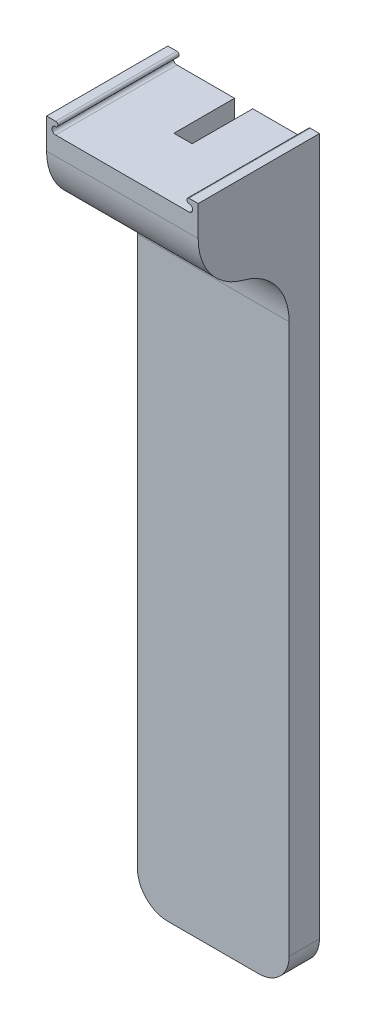
from build123d import *

# Parameters (mm, degrees)
SKICA1_W                 = 25
SKICA1_H                 = 120
P_IDAT_VYSUNUT_M1_DEPTH  = 5
SKICA2_W                 = 25
SKICA2_H                 = 15
P_IDAT_VYSUNUT_M2_DEPTH  = 20
ZAOBLIT5_R               = 5
ZAOBLIT6_R               = 5
ODEBRAT_VYSUNUT_M2_DEPTH = 20
ZAOBLIT7_R               = 10
ZAOBLIT8_R               = 10
SKICA4_W                 = 3
SKICA4_H                 = 10
ODEBRAT_VYSUNUT_M3_DEPTH = 3


with BuildPart() as part:
    # Skica1 → Přidat vysunutím1 (new body)
    with BuildSketch(Plane.XY):
        with Locations((12.5, 60)):
            Rectangle(SKICA1_W, SKICA1_H)
    extrude(amount=P_IDAT_VYSUNUT_M1_DEPTH)

    # Skica2 → Přidat vysunutím2 (add)
    with BuildSketch(Plane(origin=(0, 0, 0), x_dir=(-1, 0, 0), z_dir=(0, 0, -1))):
        with Locations((-12.5, 112.5)):
            Rectangle(SKICA2_W, SKICA2_H)
    extrude(amount=-P_IDAT_VYSUNUT_M2_DEPTH)

    # Zaoblit5
    zaoblit5_edges = [part.edges().sort_by_distance(p)[0] for p in [
        (25, 0, 2.5),
    ]]
    fillet(zaoblit5_edges, radius=ZAOBLIT5_R)

    # Zaoblit6
    zaoblit6_edges = [part.edges().sort_by_distance(p)[0] for p in [
        (0, 0, 2.5),
    ]]
    fillet(zaoblit6_edges, radius=ZAOBLIT6_R)

    # Skica3 → Odebrat vysunutím2 (cut)
    with BuildSketch(Plane.XY.offset(20)):
        with BuildLine():
            Line((1.5, 118.04), (23.5, 118.04))
            ThreePointArc((23.5, 118.04), (24.1, 118.64), (23.5, 119.24))
            ThreePointArc((23.5, 119.24), (23.12, 119.62), (23.5, 120))
            Line((23.5, 120), (1.5, 120))
            ThreePointArc((1.5, 120), (1.88, 119.62), (1.5, 119.24))
            ThreePointArc((1.5, 119.24), (0.9, 118.64), (1.5, 118.04))
        make_face()
    extrude(amount=-ODEBRAT_VYSUNUT_M2_DEPTH, mode=Mode.SUBTRACT)

    # Zaoblit7
    zaoblit7_edges = [part.edges().sort_by_distance(p)[0] for p in [
        (12.5, 105, 20),
    ]]
    fillet(zaoblit7_edges, radius=ZAOBLIT7_R)

    # Zaoblit8
    zaoblit8_edges = [part.edges().sort_by_distance(p)[0] for p in [
        (12.5, 105, 5),
    ]]
    fillet(zaoblit8_edges, radius=ZAOBLIT8_R)

    # Skica4 → Odebrat vysunutím3 (cut)
    with BuildSketch(Plane(origin=(0, 118.04, 0), x_dir=(1, 0, 0), z_dir=(0, 1, 0))):
        with Locations((12.5, -5)):
            Rectangle(SKICA4_W, SKICA4_H)
    extrude(amount=-ODEBRAT_VYSUNUT_M3_DEPTH, mode=Mode.SUBTRACT)


solid = part.part
